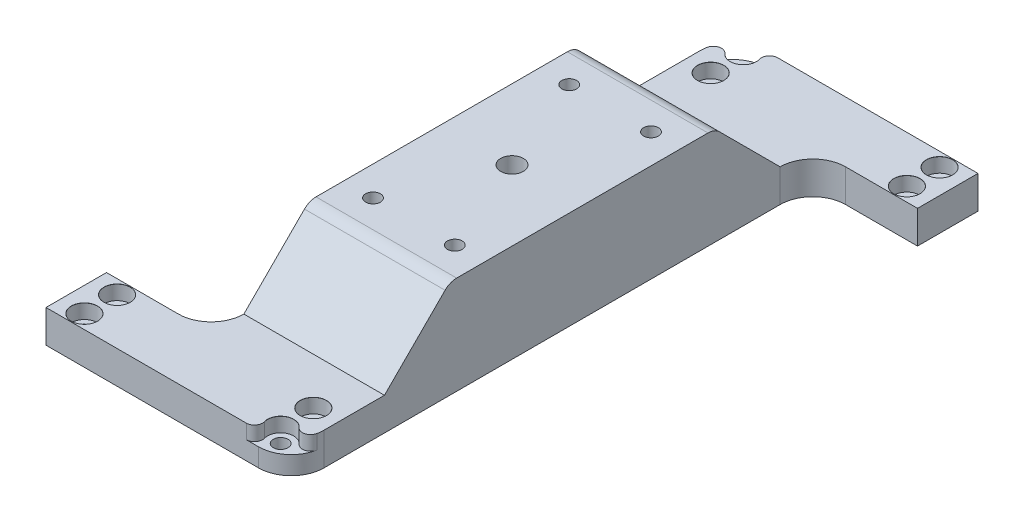
from build123d import *

# Parameters (mm, degrees)
BOSS_EXTRUDE1_DEPTH                          = 10
FILLET1_R                                    = 10
SKETCH2_R                                    = 1.75
CUT_EXTRUDE1_DEPTH                           = 10
CBORE_FOR_M4_HEX_SOCKET_HEAD_CAP_SCR_2_COUNT = 2
CBORE_FOR_M4_HEX_SOCKET_HEAD_CAP_SCR_2_PITCH = 10
CBORE_FOR_M4_HEX_SOCKET_HEAD_CAP_SCR_3_COUNT = 2
CBORE_FOR_M4_HEX_SOCKET_HEAD_CAP_SCR_3_PITCH = 60
CBORE_FOR_M4_HEX_SOCKET_HEAD_CAP_SCR_4_COUNT = 2
CBORE_FOR_M4_HEX_SOCKET_HEAD_CAP_SCR_4_PITCH = 152.099474029
CBORE_FOR_M4_HEX_SOCKET_HEAD_CAP_SCR_5_COUNT = 2
CBORE_FOR_M4_HEX_SOCKET_HEAD_CAP_SCR_5_PITCH = 161.939031737
CBORE_FOR_M4_HEX_SOCKET_HEAD_CAP_SCR_6_COUNT = 2
CBORE_FOR_M4_HEX_SOCKET_HEAD_CAP_SCR_6_PITCH = 162.67836365
CBORE_FOR_M4_HEX_SOCKET_HEAD_CAP_SCR_7_COUNT = 2
CBORE_FOR_M4_HEX_SOCKET_HEAD_CAP_SCR_7_PITCH = 152.886395732
CBORE_FOR_M4_HEX_SOCKET_HEAD_CAP_SCR_8_COUNT = 2
CBORE_FOR_M4_HEX_SOCKET_HEAD_CAP_SCR_8_PITCH = 60.827625303
FILLET2_R                                    = 2.5
FILLET3_R                                    = 2.5
SKETCH5_W                                    = 43
SKETCH5_H                                    = 121
BOSS_EXTRUDE2_DEPTH                          = 20
CHAMFER1_SIZE                                = 20
SKETCH6_R                                    = 3.462541839
CUT_EXTRUDE2_DEPTH                           = 20
SKETCH7_R                                    = 2.25
CUT_EXTRUDE3_DEPTH                           = 20
FILLET4_R                                    = 5


# Some blends are built 0.0001 mm under size
with BuildPart() as part:
    # Sketch1 → Boss-Extrude1 (new body)
    with BuildSketch(Plane(origin=(0, 0, 0), x_dir=(1, 0, 0), z_dir=(0, 1, 0))):
        Polygon((-21.5, -89), (21.5, -89), (21.5, 70.5), (53.5, 70.5), (53.5, 89), (-21.5, 89), (-21.5, -70.5), (-53.5, -70.5), (-53.5, -89), align=None)
    extrude(amount=BOSS_EXTRUDE1_DEPTH)

    # Fillet1
    fillet1_edges = [part.edges().sort_by_distance(p)[0] for p in [
        (-21.5, 5, 70.5),
        (-21.5, 5, -89),
        (21.5, 5, -70.5),
        (21.5, 5, 89),
    ]]
    fillet(fillet1_edges, radius=FILLET1_R)

    # Sketch2 → Cut-Extrude1 (cut)
    with BuildSketch(Plane(origin=(0, 10, 0), x_dir=(1, 0, 0), z_dir=(0, 1, 0))):
        with Locations(Location((-14, 74.75, 0), (0, 0, 270))):
            Circle(SKETCH2_R)
        with Locations(Location((-14, 84.75, 0), (0, 0, 270))):
            Circle(SKETCH2_R)
        with Locations(Location((46, 74.75, 0), (0, 0, 270))):
            Circle(SKETCH2_R)
        with Locations(Location((46, 84.75, 0), (0, 0, 270))):
            Circle(SKETCH2_R)
        with Locations(Location((-46, -74.75, 0), (0, 0, 270))):
            Circle(SKETCH2_R)
        with Locations(Location((-46, -84.75, 0), (0, 0, 270))):
            Circle(SKETCH2_R)
        with Locations(Location((14, -74.75, 0), (0, 0, 270))):
            Circle(SKETCH2_R)
        with Locations(Location((14, -84.75, 0), (0, 0, 270))):
            Circle(SKETCH2_R)
    extrude(amount=-CUT_EXTRUDE1_DEPTH, mode=Mode.SUBTRACT)

    # Sketch4 → CBORE for M4 Hex Socket Head Cap Screw1 (revolve, cut)
    with BuildSketch(Plane(origin=(-14, 10, -74.75), x_dir=(0, 0, 1), z_dir=(1, 0, 0))):
        Polygon((0, 0), (0, 11.351936393), (2.25, 10), (2.25, 4.4), (4, 4.4), (4, 0.025), (4.025, 0), align=None)
    cbore_for_m4_hex_socket_head_cap_screw1 = revolve(axis=Axis((-14, 16.35, -74.75), (0, -1, 0)), mode=Mode.SUBTRACT)

    # CBORE for M4 Hex Socket Head Cap Scr 2: CBORE for M4 Hex Socket Head Cap Screw1 ×2
    with Locations(*[(0, 0, -i * CBORE_FOR_M4_HEX_SOCKET_HEAD_CAP_SCR_2_PITCH) for i in range(1, CBORE_FOR_M4_HEX_SOCKET_HEAD_CAP_SCR_2_COUNT)]):
        add(cbore_for_m4_hex_socket_head_cap_screw1, mode=Mode.SUBTRACT)

    # CBORE for M4 Hex Socket Head Cap Scr 3: CBORE for M4 Hex Socket Head Cap Screw1 ×2
    with Locations(*[(i * CBORE_FOR_M4_HEX_SOCKET_HEAD_CAP_SCR_3_PITCH, 0, 0) for i in range(1, CBORE_FOR_M4_HEX_SOCKET_HEAD_CAP_SCR_3_COUNT)]):
        add(cbore_for_m4_hex_socket_head_cap_screw1, mode=Mode.SUBTRACT)

    # CBORE for M4 Hex Socket Head Cap Scr 4: CBORE for M4 Hex Socket Head Cap Screw1 ×2
    with Locations(*[Vector(0.1840900514527529, 0, 0.9829093818639248) * (i * CBORE_FOR_M4_HEX_SOCKET_HEAD_CAP_SCR_4_PITCH) for i in range(1, CBORE_FOR_M4_HEX_SOCKET_HEAD_CAP_SCR_4_COUNT)]):
        add(cbore_for_m4_hex_socket_head_cap_screw1, mode=Mode.SUBTRACT)

    # CBORE for M4 Hex Socket Head Cap Scr 5: CBORE for M4 Hex Socket Head Cap Screw1 ×2
    with Locations(*[Vector(0.1729045783441913, 0, 0.9849385802107751) * (i * CBORE_FOR_M4_HEX_SOCKET_HEAD_CAP_SCR_5_PITCH) for i in range(1, CBORE_FOR_M4_HEX_SOCKET_HEAD_CAP_SCR_5_COUNT)]):
        add(cbore_for_m4_hex_socket_head_cap_screw1, mode=Mode.SUBTRACT)

    # CBORE for M4 Hex Socket Head Cap Scr 6: CBORE for M4 Hex Socket Head Cap Screw1 ×2
    with Locations(*[Vector(-0.19670716671795496, 0, 0.9804622841097942) * (i * CBORE_FOR_M4_HEX_SOCKET_HEAD_CAP_SCR_6_PITCH) for i in range(1, CBORE_FOR_M4_HEX_SOCKET_HEAD_CAP_SCR_6_COUNT)]):
        add(cbore_for_m4_hex_socket_head_cap_screw1, mode=Mode.SUBTRACT)

    # CBORE for M4 Hex Socket Head Cap Scr 7: CBORE for M4 Hex Socket Head Cap Screw1 ×2
    with Locations(*[Vector(-0.20930573872668637, 0, 0.9778502481137263) * (i * CBORE_FOR_M4_HEX_SOCKET_HEAD_CAP_SCR_7_PITCH) for i in range(1, CBORE_FOR_M4_HEX_SOCKET_HEAD_CAP_SCR_7_COUNT)]):
        add(cbore_for_m4_hex_socket_head_cap_screw1, mode=Mode.SUBTRACT)

    # CBORE for M4 Hex Socket Head Cap Scr 8: CBORE for M4 Hex Socket Head Cap Screw1 ×2
    with Locations(*[Vector(0.9863939238321426, 0, -0.1643989873053641) * (i * CBORE_FOR_M4_HEX_SOCKET_HEAD_CAP_SCR_8_PITCH) for i in range(1, CBORE_FOR_M4_HEX_SOCKET_HEAD_CAP_SCR_8_COUNT)]):
        add(cbore_for_m4_hex_socket_head_cap_screw1, mode=Mode.SUBTRACT)

    # Fillet2
    # the kernel refuses this fillet: 2.5 mm, written as the material it takes off along each edge
    with BuildSketch(Plane(origin=(-13.754801439, 5.6, -88.742477635), x_dir=(0.9990847033117879, 0, -0.042775642699985884), z_dir=(0, 1, 0))) as fillet2_piece_1:
        with BuildLine():
            CenterArc((5.91336471, -2.497711758), FILLET2_R, 87.548388178, 105.618498276)
            Line((3.479087926, -3.067182162), (3.235660248, -3.124129202))
            ThreePointArc((3.235660248, -3.124129202), (2.064143441, -1.165399671), (-0.025984683, -0.248645925))
            Line((-0.025984683, -0.248645925), (-0.045899922, 0.245750274))
            ThreePointArc((-0.045899922, 0.245750274), (2.274447223, 0.410607251), (6.030997727, 0.249771176))
            Line((6.030997727, 0.249771176), (6.020303816, 0))
        make_face()
    extrude(amount=19.425759541, mode=Mode.SUBTRACT)
    with BuildSketch(Plane(origin=(-17.087010961, 5.6, -87.293690886), x_dir=(-0.5524220177087732, 0, 0.8335645831911094), z_dir=(0, 1, 0))) as fillet2_piece_2:
        with BuildLine():
            CenterArc((6.697143458, 2.309687979), FILLET2_R, 165.124054411, 127.376595494)
            ThreePointArc((4.280933593, 2.951505625), (2.685480046, 0.685252699), (0, 0))
            ThreePointArc((0, 0), (3.826939119, -0.761248083), (7.653878238, 0))
        make_face()
    extrude(amount=23.509695594, mode=Mode.SUBTRACT)

    # Fillet3
    # the kernel refuses this fillet: 2.5 mm, written as the material it takes off along each edge
    with BuildSketch(Plane(origin=(13.75480144, 5.6, 88.742477635), x_dir=(-0.7777172566996915, 0, -0.6286142446934416), z_dir=(0, 1, 0))) as fillet3_piece_1:
        with BuildLine():
            CenterArc((6.087462048, 2.036971289), FILLET3_R, 128.947957862, 105.618498276)
            Line((4.515926436, 3.98126443), (4.358772875, 4.175693744))
            ThreePointArc((4.358772875, 4.175693744), (1.434562202, 1.812109205), (-0.196946455, 0.153987317))
            Line((-0.196946455, 0.153987317), (0.144939573, -0.203697129))
            ThreePointArc((0.144939573, -0.203697129), (2.319033161, 0.490845938), (4.49312675, -0.203697129))
            Line((4.49312675, -0.203697129), (4.638066322, 0))
        make_face()
    extrude(amount=19.425759541, mode=Mode.SUBTRACT)
    with BuildSketch(Plane(origin=(17.087010961, 5.6, 87.293690886), x_dir=(-0.018344711955799436, 0, -0.9998317216128216), z_dir=(0, 1, 0))) as fillet3_piece_2:
        with BuildLine():
            CenterArc((6.824719559, -1.89989263), FILLET3_R, 130.539588182, 127.376595494)
            ThreePointArc((6.30136363, -4.344498645), (2.718581752, -2.798977477), (0, 0))
            ThreePointArc((0, 0), (2.599893165, -0.960171793), (5.19978633, 0))
        make_face()
    extrude(amount=23.509695594, mode=Mode.SUBTRACT)

    # Sketch5 → Boss-Extrude2 (add)
    with BuildSketch(Plane(origin=(0, 10, 0), x_dir=(1, 0, 0), z_dir=(0, 1, 0))):
        Rectangle(SKETCH5_W, SKETCH5_H)
    extrude(amount=BOSS_EXTRUDE2_DEPTH)

    # Chamfer1
    chamfer1_edges = [part.edges().sort_by_distance(p)[0] for p in [
        (0, 30, -60.5),
        (0, 30, 60.5),
    ]]
    chamfer(chamfer1_edges, length=CHAMFER1_SIZE - 0.0001)  # a hair under: the kernel refuses the full size

    # Sketch6 → Cut-Extrude2 (cut)
    with BuildSketch(Plane(origin=(0, 30, 0), x_dir=(1, 0, 0), z_dir=(0, 1, 0))):
        with Locations(Location((0, 0, 0), (0, 0, 270))):
            Circle(SKETCH6_R)
    extrude(amount=-CUT_EXTRUDE2_DEPTH, mode=Mode.SUBTRACT)

    # Sketch7 → Cut-Extrude3 (cut)
    with BuildSketch(Plane(origin=(0, 30, 0), x_dir=(1, 0, 0), z_dir=(0, 1, 0))):
        with Locations(Location((-12.5, 30, 0), (0, 0, 270))):
            Circle(SKETCH7_R)
        with Locations(Location((12.5, 30, 0), (0, 0, 270))):
            Circle(SKETCH7_R)
        with Locations(Location((12.5, -30, 0), (0, 0, 270))):
            Circle(SKETCH7_R)
        with Locations(Location((-12.5, -30, 0), (0, 0, 270))):
            Circle(SKETCH7_R)
    extrude(amount=-CUT_EXTRUDE3_DEPTH, mode=Mode.SUBTRACT)

    # Fillet4
    fillet4_edges = [part.edges().sort_by_distance(p)[0] for p in [
        (0, 30, 40.5001),
        (0, 30, -40.5001),
    ]]
    fillet(fillet4_edges, radius=FILLET4_R)


solid = part.part
